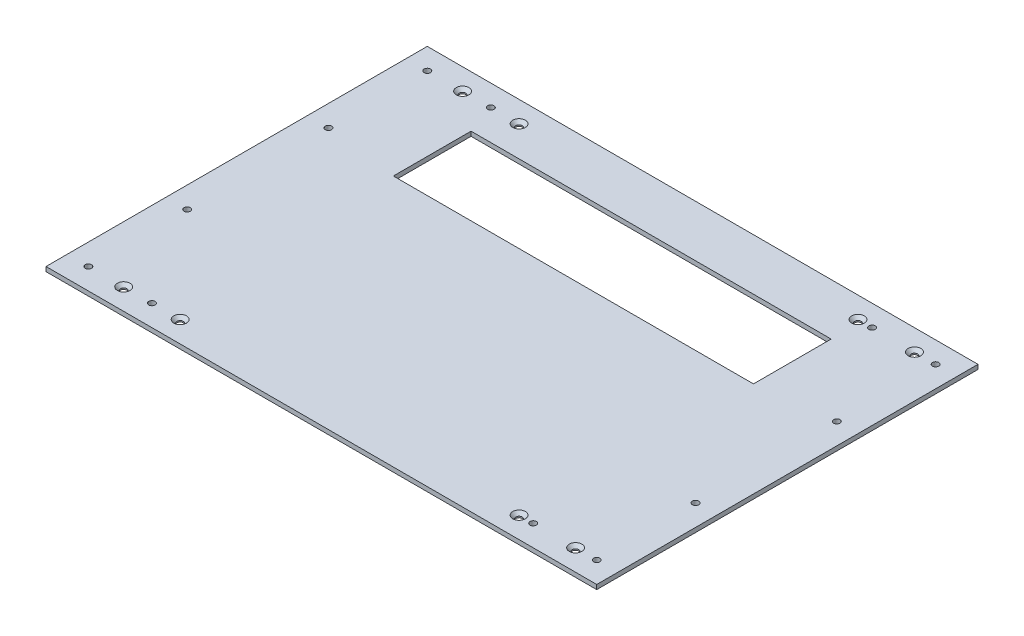
from build123d import *

# Parameters (mm, degrees)
SKETCH1_W                            = 390
SKETCH1_H                            = 270
BOSS_EXTRUDE1_DEPTH                  = 3.175
CSK_FOR_M4_SFHCS2_AT_2_COUNT         = 2
CSK_FOR_M4_SFHCS2_AT_2_PITCH         = 40
CSK_FOR_M4_SFHCS2_AT_3_COUNT         = 2
CSK_FOR_M4_SFHCS2_AT_3_PITCH         = 280
CSK_FOR_M4_SFHCS2_AT_4_COUNT         = 2
CSK_FOR_M4_SFHCS2_AT_4_PITCH         = 320
M4_CLEARANCE_HOLE1_D                 = 4.5
MIRROR3_AT_THE_SECOND_PLANE_COPY_1_D = 4.5
SKETCH10_W                           = 255
SKETCH10_H                           = 55
CUT_EXTRUDE1_DEPTH                   = 3.175


with BuildPart() as part:
    # Sketch1 → Boss-Extrude1 (new body)
    with BuildSketch(Plane(origin=(0, 0, 0), x_dir=(1, 0, 0), z_dir=(0, 1, 0))):
        Rectangle(SKETCH1_W, SKETCH1_H)
    extrude(amount=BOSS_EXTRUDE1_DEPTH)

    # Sketch6 → CSK for M4 SFHCS2 (revolve, cut)
    with BuildSketch(Plane(origin=(-155, 3.175, -120), x_dir=(0, 0, 1), z_dir=(1, 0, 0))):
        Polygon((0, 0), (0, 3.175), (2.25, 3.175), (2.25, 2.23), (4.48, 0), align=None)
    csk_for_m4_sfhcs2 = revolve(axis=Axis((-155, 9.525, -120), (0, -1, 0)), mode=Mode.SUBTRACT)

    # CSK for M4 SFHCS2 at 2: CSK for M4 SFHCS2 ×2
    with Locations(*[(i * CSK_FOR_M4_SFHCS2_AT_2_PITCH, 0, 0) for i in range(1, CSK_FOR_M4_SFHCS2_AT_2_COUNT)]):
        add(csk_for_m4_sfhcs2, mode=Mode.SUBTRACT)

    # CSK for M4 SFHCS2 at 3: CSK for M4 SFHCS2 ×2
    with Locations(*[(i * CSK_FOR_M4_SFHCS2_AT_3_PITCH, 0, 0) for i in range(1, CSK_FOR_M4_SFHCS2_AT_3_COUNT)]):
        add(csk_for_m4_sfhcs2, mode=Mode.SUBTRACT)

    # CSK for M4 SFHCS2 at 4: CSK for M4 SFHCS2 ×2
    with Locations(*[(i * CSK_FOR_M4_SFHCS2_AT_4_PITCH, 0, 0) for i in range(1, CSK_FOR_M4_SFHCS2_AT_4_COUNT)]):
        add(csk_for_m4_sfhcs2, mode=Mode.SUBTRACT)

    # Mirror2: CSK for M4 SFHCS2 across plane
    add(csk_for_m4_sfhcs2.mirror(Plane.XY), mode=Mode.SUBTRACT)

    # Mirror2 copy 1 sketch → Mirror2 copy 1 (revolve, cut)
    with BuildSketch(Plane(origin=(-115, 3.175, 120), x_dir=(0, 0, -1), z_dir=(1, 0, 0))):
        Polygon((0, 0), (0, -3.175), (2.25, -3.175), (2.25, -2.23), (4.48, 0), align=None)
    revolve(axis=Axis((-115, 9.525, 120), (0, 1, 0)), mode=Mode.SUBTRACT)

    # Mirror2 copy 2 sketch → Mirror2 copy 2 (revolve, cut)
    with BuildSketch(Plane(origin=(125, 3.175, 120), x_dir=(0, 0, -1), z_dir=(1, 0, 0))):
        Polygon((0, 0), (0, -3.175), (2.25, -3.175), (2.25, -2.23), (4.48, 0), align=None)
    revolve(axis=Axis((125, 9.525, 120), (0, 1, 0)), mode=Mode.SUBTRACT)

    # Mirror2 copy 3 sketch → Mirror2 copy 3 (revolve, cut)
    with BuildSketch(Plane(origin=(165, 3.175, 120), x_dir=(0, 0, -1), z_dir=(1, 0, 0))):
        Polygon((0, 0), (0, -3.175), (2.25, -3.175), (2.25, -2.23), (4.48, 0), align=None)
    revolve(axis=Axis((165, 9.525, 120), (0, 1, 0)), mode=Mode.SUBTRACT)

    # M4 Clearance Hole1 (through all)
    with Locations(Plane(origin=(0, 3.175, 0), x_dir=(1, 0, 0), z_dir=(0, 1, 0))):
        with Locations((-180, 120), (-180, 50), (-135, 120)):
            m4_clearance_hole1 = Hole(M4_CLEARANCE_HOLE1_D / 2)

    # Mirror3: M4 Clearance Hole1 across plane
    add(m4_clearance_hole1.mirror(Plane(origin=(0, 0, 0), x_dir=(0, 0, 1), z_dir=(1, 0, 0))), mode=Mode.SUBTRACT)

    # Mirror3 at the second plane: M4 Clearance Hole1 across plane
    add(m4_clearance_hole1.mirror(Plane.XY), mode=Mode.SUBTRACT)

    # Mirror3 at the second plane copy 1 (through all)
    with Locations(Plane(origin=(0, 3.175, 0), x_dir=(-1, 0, 0), z_dir=(0, 1, 0))):
        with Locations((-180, 120), (-180, 50), (-135, 120)):
            Hole(MIRROR3_AT_THE_SECOND_PLANE_COPY_1_D / 2)

    # Sketch10 → Cut-Extrude1 (cut)
    with BuildSketch(Plane(origin=(0, 3.175, 0), x_dir=(1, 0, 0), z_dir=(0, 1, 0))):
        with Locations((0, 71)):
            Rectangle(SKETCH10_W, SKETCH10_H)
    extrude(amount=-CUT_EXTRUDE1_DEPTH, mode=Mode.SUBTRACT)


solid = part.part
